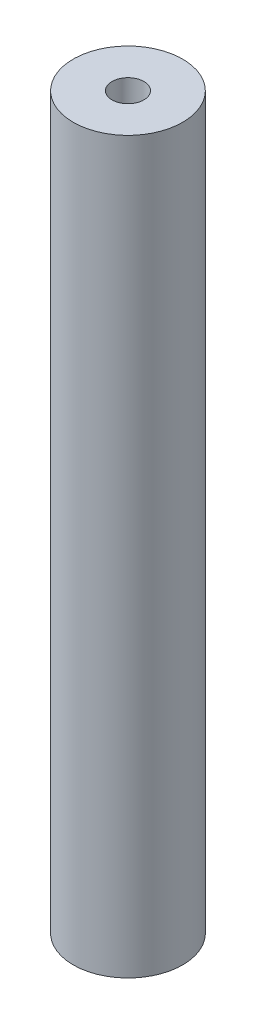
from build123d import *

# Parameters (mm, degrees)
SKETCH1_R           = 3
BOSS_EXTRUDE1_DEPTH = 40
SKETCH2_R           = 0.875
CUT_EXTRUDE1_DEPTH  = 41.224370722


with BuildPart() as part:
    # Sketch1 → Boss-Extrude1 (new body)
    with BuildSketch(Plane(origin=(0, 0, 0), x_dir=(1, 0, 0), z_dir=(0, 1, 0))):
        Circle(SKETCH1_R)
    extrude(amount=BOSS_EXTRUDE1_DEPTH)

    # Sketch2 → Cut-Extrude1 (cut, through all)
    with BuildSketch(Plane(origin=(0, 40, 0), x_dir=(1, 0, 0), z_dir=(0, 1, 0))):
        Circle(SKETCH2_R)
    extrude(amount=-CUT_EXTRUDE1_DEPTH, mode=Mode.SUBTRACT)


solid = part.part
